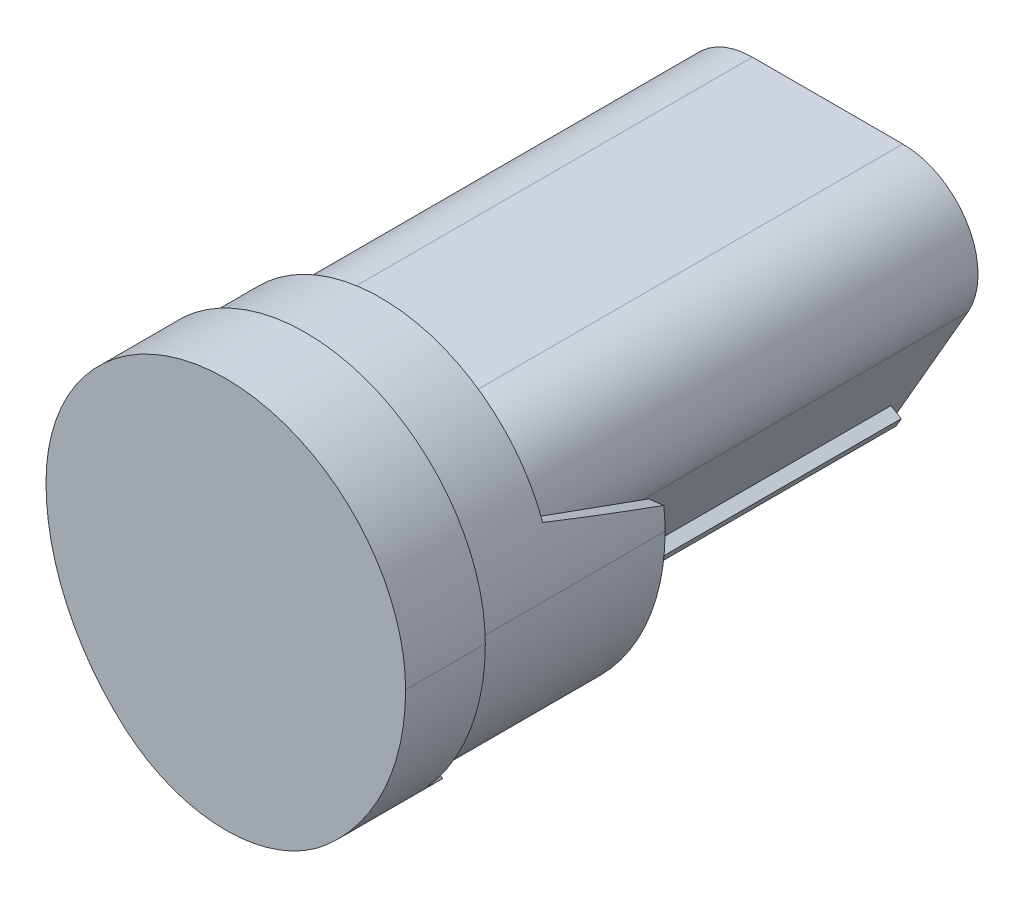
from build123d import *
from OCP.BRepFilletAPI import BRepFilletAPI_MakeChamfer

# Parameters (mm, degrees)
BOSS_EXTRU_1_DEPTH      = 80
BOSS_EXTRU_2_DEPTH      = 10.6
BOSS_EXTRU_3_DEPTH      = 10
BOSS_EXTRU_4_DEPTH      = 3.5
CHANFREIN1_SIZE         = 2
CHANFREIN1_SIZE_2       = 3.5
BOSS_EXTRU_5_DEPTH      = 14.9
CHANFREIN2_SIZE         = 5
CHANFREIN2_SIZE_2       = 14.9
ENL_V_MAT_EXTRU_1_DEPTH = 61.9
BOSS_EXTRU_8_REACH      = 92.636
BOSS_EXTRU_8_START      = -2.5


with BuildPart() as part:
    # Esquisse1 → Boss.-Extru.1 (new body)
    with BuildSketch(Plane.XY):
        with BuildLine():
            Line((-9.999999999999973, 15.773502691896244), (9.999999999999973, 15.773502691896244))
            ThreePointArc((9.999999999999973, 15.773502691896244), (18.66025403784436, 10.773502691896228), (18.66025403784438, 0.7735026918962024))
            Line((18.66025403784438, 0.7735026918962024), (8.660254037844393, -16.54700538379251))
            ThreePointArc((8.660254037844393, -16.54700538379251), (-4.87e-15, -21.5470053837925), (-8.660254037844393, -16.54700538379251))
            Line((-8.660254037844393, -16.54700538379251), (-18.66025403784438, 0.7735026918962024))
            ThreePointArc((-18.66025403784438, 0.7735026918962024), (-18.66025403784441, 10.773502691896235), (-9.999999999999973, 15.773502691896244))
        make_face()
    extrude(amount=BOSS_EXTRU_1_DEPTH)

    # Esquisse2 → Boss.-Extru.2 (add)
    with BuildSketch(Plane.XY.offset(80)):
        with BuildLine():
            Line((0, 23.773502691896258), (0, -28.226497308103742))
            ThreePointArc((0, -28.226497308103742), (-7.138520611844601, -26.935621886911633), (-13.372879499304581, -23.22649730810374))
            ThreePointArc((-13.372879499304581, -23.22649730810374), (-21.14415675858487, -12.819312855059437), (-23.89999999999999, -0.12649730810374363))
            ThreePointArc((-23.89999999999999, -0.12649730810374363), (-16.89985207035848, 16.773354762254744), (0, 23.773502691896258))
        make_face()
    boss_extru_2 = extrude(amount=-BOSS_EXTRU_2_DEPTH)

    # Symétrie1: Boss.-Extru.2 across plane
    add(boss_extru_2.mirror(Plane(origin=(0, 0, 0), x_dir=(0, 0, 1), z_dir=(1, 0, 0))))

    # Esquisse4 → Boss.-Extru.3 (add)
    with BuildSketch(Plane(origin=(0, 0, 69.4), x_dir=(-1, 0, 0), z_dir=(0, 0, -1))):
        with BuildLine():
            ThreePointArc((-12.716812029717252, -22.471795065262707), (-2.04e-15, -27.226497308103735), (12.71681202971725, -22.4717950652627))
            ThreePointArc((12.71681202971725, -22.4717950652627), (20.2341931687673, -12.404624700892555), (22.899999999999995, -0.12649730810373652))
            ThreePointArc((22.899999999999995, -0.12649730810373652), (-6.91e-15, 22.773502691896258), (-22.899999999999995, -0.12649730810373735))
            ThreePointArc((-22.899999999999995, -0.12649730810373735), (-20.234193168767305, -12.404624700892553), (-12.716812029717252, -22.471795065262707))
        make_face()
    extrude(amount=BOSS_EXTRU_3_DEPTH)

    # Esquisse6 → Boss.-Extru.4 (add)
    with BuildSketch(Plane(origin=(0, 0, 69.4), x_dir=(-1, 0, 0), z_dir=(0, 0, -1))):
        with BuildLine():
            Line((14.75, -21.95321690393977), (0, -13.476497308103742))
            Line((0, -13.476497308103742), (0, -28.226497308103742))
            ThreePointArc((0, -28.226497308103742), (7.138520611844594, -26.935621886911633), (13.372879499304576, -23.226497308103735))
            ThreePointArc((13.372879499304576, -23.226497308103735), (14.071194795630928, -22.600407707254973), (14.75, -21.95321690393977))
        make_face()
    boss_extru_4 = extrude(amount=BOSS_EXTRU_4_DEPTH)

    # Symétrie2: Boss.-Extru.4 across plane
    add(boss_extru_4.mirror(Plane(origin=(0, 0, 0), x_dir=(0, 0, 1), z_dir=(1, 0, 0))))

    # Chanfrein1
    chanfrein1_edges_1 = [part.edges().sort_by_distance(p)[0] for p in [
        (-14.299309891443901, -21.69420851920438, 69.4),
    ]]
    chanfrein1_side_1 = [part.faces().sort_by_distance(p)[0] for p in [
        (-14.319240730556658, -21.659527664943543, 69.4),
    ]]
    chanfrein1_edges_2 = [part.edges().sort_by_distance(p)[0] for p in [
        (14.299309891443906, -21.694208519204384, 69.4),
    ]]
    chanfrein1_side_2 = [part.faces().sort_by_distance(p)[0] for p in [
        (14.319240730556663, -21.659527664943546, 69.4),
    ]]
    chanfrein1 = BRepFilletAPI_MakeChamfer(part.part.solid().wrapped)
    for e in chanfrein1_edges_1:
        chanfrein1.Add(CHANFREIN1_SIZE - 0.0001, CHANFREIN1_SIZE_2 - 0.0001, e.wrapped, chanfrein1_side_1[0].wrapped)
    for e in chanfrein1_edges_2:
        chanfrein1.Add(CHANFREIN1_SIZE - 0.0001, CHANFREIN1_SIZE_2 - 0.0001, e.wrapped, chanfrein1_side_2[0].wrapped)
    add(Compound.cast(chanfrein1.Shape()), mode=Mode.REPLACE)  # a hair under: the kernel refuses the full size

    # Esquisse7 → Boss.-Extru.5 (add)
    with BuildSketch(Plane(origin=(0, 0, 59.4), x_dir=(-1, 0, 0), z_dir=(0, 0, -1))):
        with BuildLine():
            Line((-6.79e-15, -27.22649730810374), (0, 0))
            Line((0, 0), (22.71563338320109, 2.7735026918962267))
            ThreePointArc((22.71563338320109, 2.7735026918962267), (22.853861867037974, 1.3264299999015228), (22.899999999999995, -0.12649730810374016))
            ThreePointArc((22.899999999999995, -0.12649730810374016), (20.2341931687673, -12.404624700892562), (12.716812029717245, -22.471795065262707))
            ThreePointArc((12.716812029717245, -22.471795065262707), (6.788307992740876, -25.998951656029643), (-6.79e-15, -27.22649730810374))
        make_face()
    boss_extru_5 = extrude(amount=BOSS_EXTRU_5_DEPTH)

    # Symétrie4: Boss.-Extru.5 across plane
    add(boss_extru_5.mirror(Plane(origin=(0, 0, 0), x_dir=(0, 0, 1), z_dir=(1, 0, 0))))

    # Chanfrein2
    chanfrein2_edges_1 = [part.edges().sort_by_distance(p)[0] for p in [
        (21.059128460282075, 2.5712489935136453, 59.4),
    ]]
    chanfrein2_side_1 = [part.faces().sort_by_distance(p)[0] for p in [
        (21.04700879877706, 2.6705118456034573, 59.4),
    ]]
    chanfrein2_edges_2 = [part.edges().sort_by_distance(p)[0] for p in [
        (-21.059128460282082, 2.571248993513646, 59.4),
    ]]
    chanfrein2_side_2 = [part.faces().sort_by_distance(p)[0] for p in [
        (-21.059128460282082, 2.571248993513646, 59.3),
    ]]
    chanfrein2 = BRepFilletAPI_MakeChamfer(part.part.solid().wrapped)
    for e in chanfrein2_edges_1:
        chanfrein2.Add(CHANFREIN2_SIZE - 0.0001, CHANFREIN2_SIZE_2 - 0.0001, e.wrapped, chanfrein2_side_1[0].wrapped)
    for e in chanfrein2_edges_2:
        chanfrein2.Add(CHANFREIN2_SIZE_2 - 0.0001, CHANFREIN2_SIZE - 0.0001, e.wrapped, chanfrein2_side_2[0].wrapped)
    add(Compound.cast(chanfrein2.Shape()), mode=Mode.REPLACE)  # a hair under: the kernel refuses the full size

    # Esquisse8 → Enlèv. mat.-Extru.1 (cut)
    with BuildSketch(Plane(origin=(0, 0, 0), x_dir=(-1, 0, 0), z_dir=(0, 0, -1))):
        with BuildLine():
            Line((-20.73173527113113, 2.5202275827259273), (-20.108299540895768, 7.138156637600371))
            ThreePointArc((-20.108299540895768, 7.138156637600371), (-18.785258977060302, 10.95609130242486), (-16.08354229758742, 13.96071913666333))
            Line((-16.08354229758742, 13.96071913666333), (-12.465297452899778, 16.64926972087978))
            ThreePointArc((-12.465297452899778, 16.64926972087978), (8.34e-15, 20.773502691896244), (12.465297452899788, 16.649269720879765))
            Line((12.465297452899788, 16.649269720879765), (16.083542297587456, 13.96071913666329))
            ThreePointArc((16.083542297587456, 13.96071913666329), (18.78525897706036, 10.956091302424788), (20.108299540895814, 7.13815663760026))
            Line((20.108299540895814, 7.13815663760026), (20.73173527113112, 2.5202275827259264))
            ThreePointArc((20.73173527113112, 2.5202275827259264), (20.857891398301028, 1.1995367852285772), (20.89999999999999, -0.12649730810373677))
            ThreePointArc((20.89999999999999, -0.12649730810373677), (18.414265989132176, -11.5752483925588), (11.404677090542576, -20.962390579580656))
            ThreePointArc((11.404677090542576, -20.962390579580656), (1.69e-15, -25.226497308103735), (-11.40467709054258, -20.962390579580664))
            ThreePointArc((-11.40467709054258, -20.962390579580664), (-18.414265989132176, -11.575248392558798), (-20.89999999999999, -0.1264973081037376))
            ThreePointArc((-20.89999999999999, -0.1264973081037376), (-20.85789139830103, 1.1995367852285768), (-20.73173527113113, 2.5202275827259273))
        make_face()
        with BuildLine():
            Line((-18.66025403784436, 0.773502691896218), (-8.660254037844393, -16.54700538379251))
            ThreePointArc((-8.660254037844393, -16.54700538379251), (6.09e-15, -21.547005383792524), (8.660254037844393, -16.54700538379251))
            Line((8.660254037844393, -16.54700538379251), (18.66025403784438, 0.7735026918962024))
            ThreePointArc((18.66025403784438, 0.7735026918962024), (18.66025403784438, 10.773502691896217), (9.999999999999973, 15.773502691896226))
            Line((9.999999999999973, 15.773502691896226), (-9.999999999999973, 15.773502691896244))
            ThreePointArc((-9.999999999999973, 15.773502691896244), (-18.660254037844357, 10.77350269189623), (-18.66025403784436, 0.773502691896218))
        make_face(mode=Mode.SUBTRACT)
    extrude(amount=-ENL_V_MAT_EXTRU_1_DEPTH, mode=Mode.SUBTRACT)

    # Esquisse9 → Boss.-Extru.8 (add, up to next)
    with BuildSketch(Plane(origin=(0, 0, 0), x_dir=(-1, 0, 0), z_dir=(0, 0, -1)).offset(BOSS_EXTRU_8_START), mode=Mode.PRIVATE) as boss_extru_8_sk1:
        Polygon((-10.214359353944898, -13.855216015993522), (-11.599999999999998, -14.655216015993522), (-12.3, -13.442780450695311), (-10.914359353944906, -12.642780450695314), align=None)
    boss_extru_8_tool1 = extrude(boss_extru_8_sk1.sketch, amount=-BOSS_EXTRU_8_REACH, mode=Mode.PRIVATE) - part.part
    # Esquisse9 → Boss.-Extru.8 (add, up to next)
    with BuildSketch(Plane(origin=(0, 0, 0), x_dir=(-1, 0, 0), z_dir=(0, 0, -1)).offset(BOSS_EXTRU_8_START), mode=Mode.PRIVATE) as boss_extru_8_sk2:
        Polygon((10.914359353944906, -12.642780450695314), (10.214359353944898, -13.855216015993522), (11.599999999999998, -14.655216015993522), (12.3, -13.442780450695311), align=None)
    boss_extru_8_tool2 = extrude(boss_extru_8_sk2.sketch, amount=-BOSS_EXTRU_8_REACH, mode=Mode.PRIVATE) - part.part
    add(boss_extru_8_tool1.solids().sort_by_distance((11.25718, -13.648998, 2.5))[0])
    add(boss_extru_8_tool2.solids().sort_by_distance((-11.25718, -13.648998, 2.5))[0])


solid = part.part
